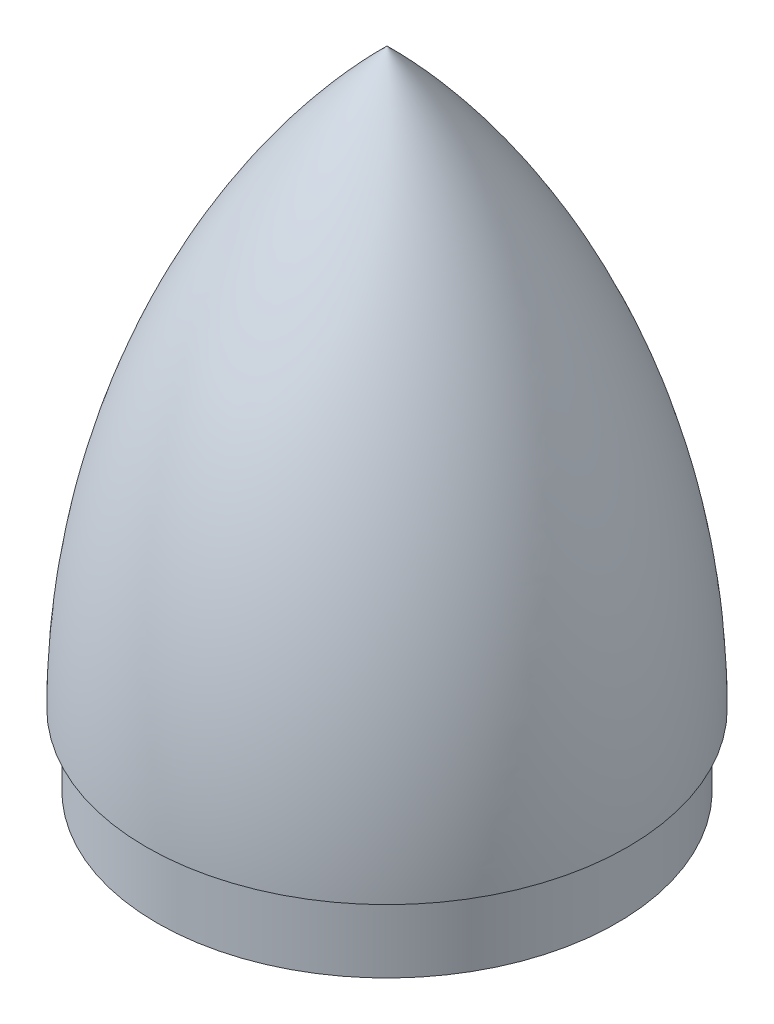
from build123d import *


with BuildPart() as part:
    # Sketch1 → Revolve1 (revolve)
    with BuildSketch(Plane(origin=(0, 0, 0), x_dir=(0, 1, 0), z_dir=(0, 0, 1))):
        with BuildLine():
            Line((0, 41.1), (12.7, 41.1))
            Line((12.7, 41.1), (12.7, 43))
            ThreePointArc((12.7, 43), (68.277086106, 31.814565717), (115.2, 0))
            Line((115.2, 0), (113.793613075, 0))
            ThreePointArc((113.793613075, 0), (78.00392469, 26.176324988), (35.906026182, 40.1))
            Line((35.906026182, 40.1), (13.7, 40.1))
            Line((13.7, 40.1), (0, 40.1))
            Line((0, 40.1), (0, 41.1))
        make_face()
    revolve(axis=Axis((0, -1000, 0), (0, 1, 0)))


solid = part.part
